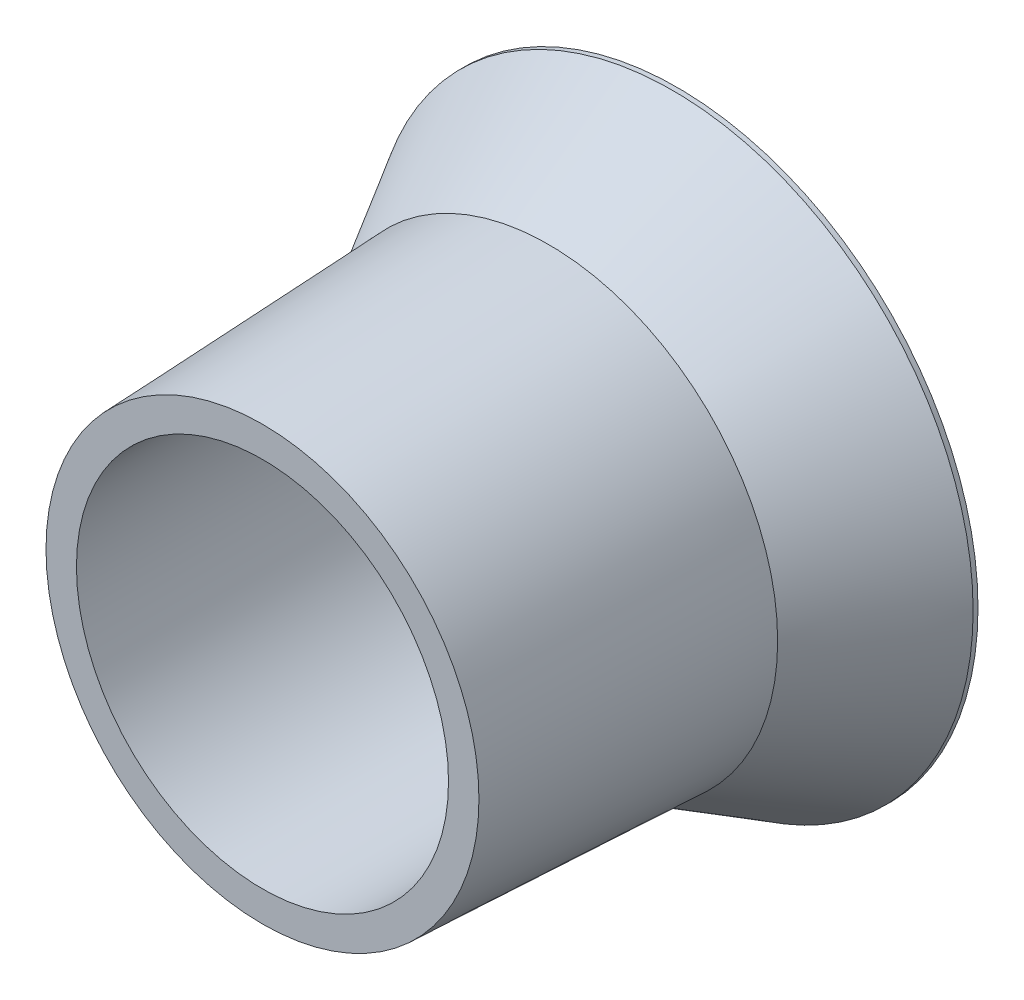
from build123d import *

# Parameters (mm, degrees)
SKETCH1_R           = 40
SKETCH1_R_2         = 32.5
BOSS_EXTRUDE1_DEPTH = 50
CHAMFER1_SIZE       = 50
CHAMFER1_SIZE_2     = 2.183047145
BOSS_EXTRUDE2_START = 22.5
SKETCH2_R           = 52.5
SKETCH2_R_2         = 32.5
BOSS_EXTRUDE2_DEPTH = 22.5
CHAMFER2_SIZE2      = 21.650635095
CHAMFER2_SIZE       = 12.5


# Some blends are built 0.0001 mm under size
with BuildPart() as part:
    # Sketch1 → Boss-Extrude1 (new body)
    with BuildSketch(Plane.XY):
        Circle(SKETCH1_R)
        Circle(SKETCH1_R_2, mode=Mode.SUBTRACT)
    extrude(amount=BOSS_EXTRUDE1_DEPTH)

    # Chamfer1
    # the kernel refuses this chamfer: 50, 2.183047145 mm, written as the material it takes off along each edge
    with BuildSketch(Plane(origin=(0, 0, 50), x_dir=(1, 0, 0), z_dir=(0, -1, 0))) as chamfer1_piece_1:
        Polygon((40, -CHAMFER1_SIZE), (40 - CHAMFER1_SIZE_2, 0), (40, 0), align=None)
    revolve(axis=Axis((0, 0, 50), (0, 0, 1)), mode=Mode.SUBTRACT)

    # Sketch2 → Boss-Extrude2 (add)
    with BuildSketch(Plane(origin=(0, 0, 0), x_dir=(-1, 0, 0), z_dir=(0, 0, -1)).offset(BOSS_EXTRUDE2_START)):
        with Locations(Location((0, 0, 0), (0, 0, 180))):
            Circle(SKETCH2_R)
        Circle(SKETCH2_R_2, mode=Mode.SUBTRACT)
    extrude(amount=-BOSS_EXTRUDE2_DEPTH)

    # Chamfer2
    chamfer2_edges = [part.edges().sort_by_distance(p)[0] for p in [
        (-52.5, 0, 0),
    ]]
    chamfer2_side = [part.faces().sort_by_distance(p)[0] for p in [
        (-52.25, 0, 0),
    ]]
    chamfer(chamfer2_edges, length=CHAMFER2_SIZE - 0.0001, length2=CHAMFER2_SIZE2 - 0.0001, reference=chamfer2_side[0])  # a hair under: the kernel refuses the full size


solid = part.part
